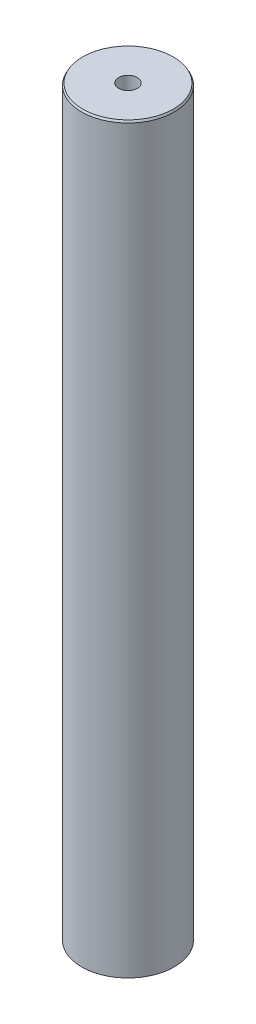
from build123d import *
from OCP.BRepFilletAPI import BRepFilletAPI_MakeChamfer

# Parameters (mm, degrees)
SKETCH1_R           = 5
BOSS_EXTRUDE1_DEPTH = 80.143895719
SKETCH2_R           = 1.00990164
CUT_EXTRUDE1_DEPTH  = 81.455229917
CHAMFER1_SIZE       = 0.207226658
CHAMFER1_SIZE2      = 0.119642367


with BuildPart() as part:
    # Sketch1 → Boss-Extrude1 (new body)
    with BuildSketch(Plane(origin=(0, 0, 0), x_dir=(1, 0, 0), z_dir=(0, 1, 0))):
        Circle(SKETCH1_R)
    extrude(amount=BOSS_EXTRUDE1_DEPTH)

    # Sketch2 → Cut-Extrude1 (cut, through all)
    with BuildSketch(Plane(origin=(0, 0, 0), x_dir=(1, 0, 0), z_dir=(0, 1, 0))):
        Circle(SKETCH2_R)
    extrude(amount=CUT_EXTRUDE1_DEPTH, mode=Mode.SUBTRACT)

    # Chamfer1: one chamfer whose edges measure the first distance from different faces: ONE call of the kernel's chamfer builder (chamfer() names one face for all edges)
    chamfer1_edges_1 = [part.edges().sort_by_distance(p)[0] for p in [
        (-5, 80.143895719, 0),
    ]]
    chamfer1_side_1 = [part.faces().sort_by_distance(p)[0] for p in [
        (-5, 40.071947859, 0),
    ]]
    chamfer1_edges_2 = [part.edges().sort_by_distance(p)[0] for p in [
        (-5, 0, 0),
    ]]
    chamfer1_side_2 = [part.faces().sort_by_distance(p)[0] for p in [
        (-4.858578644, 0, 0),
    ]]
    chamfer1 = BRepFilletAPI_MakeChamfer(part.part.solid().wrapped)
    for e in chamfer1_edges_1:
        chamfer1.Add(CHAMFER1_SIZE, CHAMFER1_SIZE2, e.wrapped, chamfer1_side_1[0].wrapped)  # the first distance lies on this face
    for e in chamfer1_edges_2:
        chamfer1.Add(CHAMFER1_SIZE, CHAMFER1_SIZE2, e.wrapped, chamfer1_side_2[0].wrapped)  # the first distance lies on this face
    add(Compound.cast(chamfer1.Shape()), mode=Mode.REPLACE)


solid = part.part
